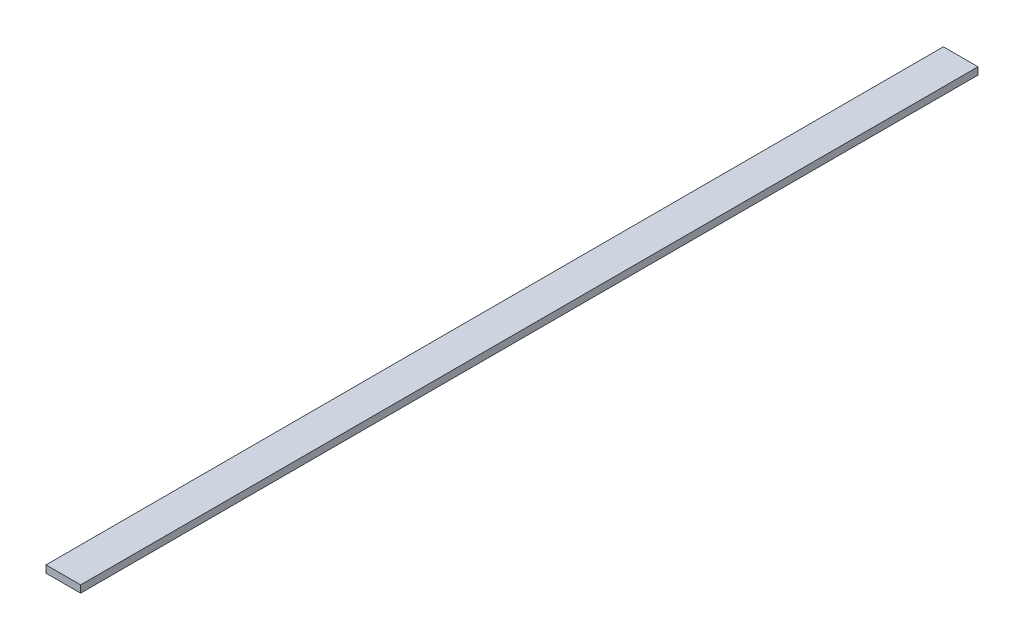
from build123d import *

# Parameters (mm, degrees)
SKETCH1_W           = 12
SKETCH1_H           = 2.5
BOSS_EXTRUDE1_DEPTH = 311


with BuildPart() as part:
    # Sketch1 → Boss-Extrude1 (new body)
    with BuildSketch(Plane.XY):
        with Locations((6, 1.25)):
            Rectangle(SKETCH1_W, SKETCH1_H)
    extrude(amount=BOSS_EXTRUDE1_DEPTH)


solid = part.part
